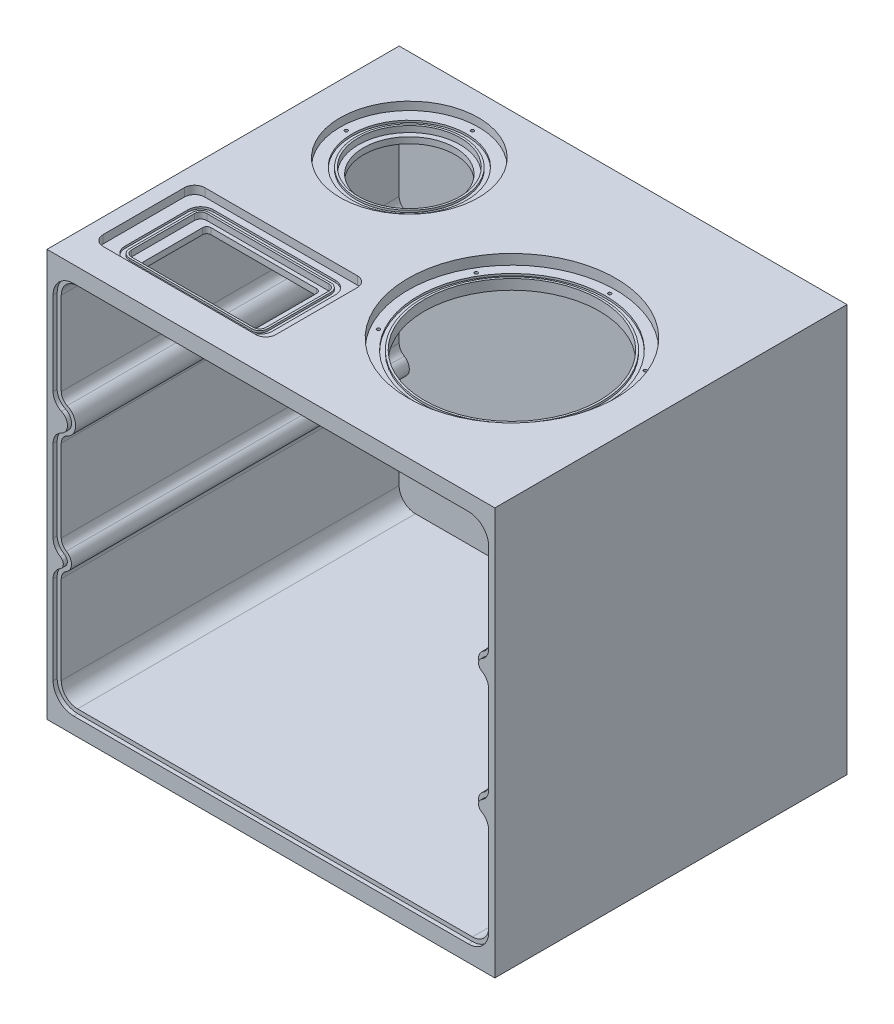
from build123d import *

# Parameters (mm, degrees)
SKETCH1_W           = 220
SKETCH1_H           = 200
BOSS_EXTRUDE1_DEPTH = 5
SKETCH1_3_W         = 220
SKETCH1_3_H         = 200
BOSS_EXTRUDE2_DEPTH = 173
FILLET1_R           = 8
FILLET2_R           = 5
SKETCH4_R           = 43
CUT_EXTRUDE3_DEPTH  = 10
SKETCH4_3_R         = 51
CUT_EXTRUDE4_DEPTH  = 5
SKETCH4_5_R         = 46
SKETCH4_5_R_2       = 44
CUT_EXTRUDE6_DEPTH  = 6
CUT_EXTRUDE9_DEPTH  = 2
SKETCH5_R           = 0.7835
CUT_EXTRUDE7_DEPTH  = 4
SKETCH6_W           = 56
SKETCH6_H           = 33
CUT_EXTRUDE8_DEPTH  = 10
SKETCH6_3_W         = 85
SKETCH6_3_H         = 50
CUT_EXTRUDE10_DEPTH = 4
SKETCH6_4_W         = 66
SKETCH6_4_H         = 37
SKETCH6_4_W_2       = 56
SKETCH6_4_H_2       = 33
CUT_EXTRUDE11_DEPTH = 7
SKETCH6_5_W         = 72.4
SKETCH6_5_H         = 43.4
SKETCH6_5_W_2       = 68
SKETCH6_5_H_2       = 39
CUT_EXTRUDE12_DEPTH = 5
FILLET3_R           = 2
FILLET4_R           = 3
FILLET5_R           = 4
FILLET6_R           = 6.2
FILLET7_R           = 5
SKETCH7_R           = 22.5
CUT_EXTRUDE13_DEPTH = 10
SKETCH7_3_R         = 25
SKETCH7_3_R_2       = 22.5
CUT_EXTRUDE14_DEPTH = 7
SKETCH7_4_R         = 34
SKETCH7_4_R_2       = 28.2
SKETCH7_4_R_3       = 26
SKETCH7_4_R_4       = 25
CUT_EXTRUDE15_DEPTH = 4
SKETCH7_5_R         = 28.2
SKETCH7_5_R_2       = 26
CUT_EXTRUDE16_DEPTH = 5
SKETCH8_R           = 0.7835
CUT_EXTRUDE17_DEPTH = 5


with BuildPart() as part:
    # Sketch1 → Boss-Extrude1 (new body)
    with BuildSketch(Plane.XY):
        Rectangle(SKETCH1_W, SKETCH1_H)
    extrude(amount=BOSS_EXTRUDE1_DEPTH)

    # Sketch1<3> → Boss-Extrude2 (add)
    with BuildSketch(Plane.XY):
        Rectangle(SKETCH1_3_W, SKETCH1_3_H)
        with BuildLine():
            Line((-105, 22.92983697), (-105, -25))
            ThreePointArc((-105, -25), (-100, -30), (-105, -35))
            Line((-105, -35), (-105, -90))
            Line((-105, -90), (105, -90))
            Line((105, -90), (105, -35))
            ThreePointArc((105, -35), (100, -30), (105, -25))
            Line((105, -25), (105, 25))
            ThreePointArc((105, 25), (100, 30), (105, 35))
            Line((105, 35), (105, 90))
            Line((105, 90), (-105, 90))
            Line((-105, 90), (-105, 37.07016303))
            ThreePointArc((-105, 37.07016303), (-97.92983697, 30), (-105, 22.92983697))
        make_face(mode=Mode.SUBTRACT)
    extrude(amount=BOSS_EXTRUDE2_DEPTH)

    # Fillet1
    fillet1_edges = [part.edges().sort_by_distance(p)[0] for p in [
        (105, -90, 89),
        (-105, -90, 89),
        (105, 90, 89),
        (-105, 90, 89),
    ]]
    fillet(fillet1_edges, radius=FILLET1_R)

    # Fillet2
    fillet2_edges = [part.edges().sort_by_distance(p)[0] for p in [
        (105, -35, 89),
        (105, -25, 89),
        (105, 35, 89),
        (105, 25, 89),
        (-105, 37.07016303, 89),
        (-105, 22.92983697, 89),
        (-105, -25, 89),
        (-105, -35, 89),
    ]]
    fillet(fillet2_edges, radius=FILLET2_R)

    # Sketch4 → Cut-Extrude3 (cut)
    with BuildSketch(Plane(origin=(0, 100, 0), x_dir=(1, 0, 0), z_dir=(0, 1, 0))):
        with Locations((42, -96.6)):
            Circle(SKETCH4_R)
    extrude(amount=-CUT_EXTRUDE3_DEPTH, mode=Mode.SUBTRACT)

    # Sketch4<3> → Cut-Extrude4 (cut)
    with BuildSketch(Plane(origin=(0, 100, 0), x_dir=(1, 0, 0), z_dir=(0, 1, 0))):
        with Locations((42, -96.6)):
            Circle(SKETCH4_3_R)
    extrude(amount=-CUT_EXTRUDE4_DEPTH, mode=Mode.SUBTRACT)

    # Sketch4<5> → Cut-Extrude6 (cut)
    with BuildSketch(Plane(origin=(0, 100, 0), x_dir=(1, 0, 0), z_dir=(0, 1, 0))):
        with Locations((42, -96.6)):
            Circle(SKETCH4_5_R)
        with Locations((42, -96.6)):
            Circle(SKETCH4_5_R_2, mode=Mode.SUBTRACT)
    extrude(amount=-CUT_EXTRUDE6_DEPTH, mode=Mode.SUBTRACT)

    # Sketch2 → Cut-Extrude9 (cut)
    with BuildSketch(Plane.XY.offset(173)):
        with BuildLine():
            Line((107, -82), (107, -38.660254038))
            ThreePointArc((107, -38.660254038), (106.062177826, -35.160254038), (103.5, -32.598076211))
            ThreePointArc((103.5, -32.598076211), (102, -30), (103.5, -27.401923789))
            ThreePointArc((103.5, -27.401923789), (106.062177826, -24.839745962), (107, -21.339745962))
            Line((107, -21.339745962), (107, 21.339745962))
            ThreePointArc((107, 21.339745962), (106.062177826, 24.839745962), (103.5, 27.401923789))
            ThreePointArc((103.5, 27.401923789), (102, 30), (103.5, 32.598076211))
            ThreePointArc((103.5, 32.598076211), (106.062177826, 35.160254038), (107, 38.660254038))
            Line((107, 38.660254038), (107, 82))
            ThreePointArc((107, 82), (104.071067812, 89.071067812), (97, 92))
            Line((97, 92), (-97, 92))
            ThreePointArc((-97, 92), (-104.071067812, 89.071067812), (-107, 82))
            Line((-107, 82), (-107, 40.985847057))
            ThreePointArc((-107, 40.985847057), (-105.886339524, 37.197574759), (-102.899712283, 34.614687926))
            ThreePointArc((-102.899712283, 34.614687926), (-99.92983697, 30), (-102.899712283, 25.385312074))
            ThreePointArc((-102.899712283, 25.385312074), (-105.886339524, 22.802425241), (-107, 19.014152943))
            Line((-107, 19.014152943), (-107, -21.339745962))
            ThreePointArc((-107, -21.339745962), (-106.062177826, -24.839745962), (-103.5, -27.401923789))
            ThreePointArc((-103.5, -27.401923789), (-102, -30), (-103.5, -32.598076211))
            ThreePointArc((-103.5, -32.598076211), (-106.062177826, -35.160254038), (-107, -38.660254038))
            Line((-107, -38.660254038), (-107, -82))
            ThreePointArc((-107, -82), (-104.071067812, -89.071067812), (-97, -92))
            Line((-97, -92), (97, -92))
            ThreePointArc((97, -92), (104.071067812, -89.071067812), (107, -82))
        make_face()
        with BuildLine():
            Line((105, -82), (105, -38.660254038))
            ThreePointArc((105, -38.660254038), (104.330127019, -36.160254038), (102.5, -34.330127019))
            ThreePointArc((102.5, -34.330127019), (100, -30), (102.5, -25.669872981))
            ThreePointArc((102.5, -25.669872981), (104.330127019, -23.839745962), (105, -21.339745962))
            Line((105, -21.339745962), (105, 21.339745962))
            ThreePointArc((105, 21.339745962), (104.330127019, 23.839745962), (102.5, 25.669872981))
            ThreePointArc((102.5, 25.669872981), (100, 30), (102.5, 34.330127019))
            ThreePointArc((102.5, 34.330127019), (104.330127019, 36.160254038), (105, 38.660254038))
            Line((105, 38.660254038), (105, 82))
            ThreePointArc((105, 82), (102.656854249, 87.656854249), (97, 90))
            Line((97, 90), (-97, 90))
            ThreePointArc((-97, 90), (-102.656854249, 87.656854249), (-105, 82))
            Line((-105, 82), (-105, 40.985847057))
            ThreePointArc((-105, 40.985847057), (-104.204528231, 38.279938273), (-102.07122306, 36.435019107))
            ThreePointArc((-102.07122306, 36.435019107), (-97.92983697, 30), (-102.07122306, 23.564980893))
            ThreePointArc((-102.07122306, 23.564980893), (-104.204528231, 21.720061727), (-105, 19.014152943))
            Line((-105, 19.014152943), (-105, -21.339745962))
            ThreePointArc((-105, -21.339745962), (-104.330127019, -23.839745962), (-102.5, -25.669872981))
            ThreePointArc((-102.5, -25.669872981), (-100, -30), (-102.5, -34.330127019))
            ThreePointArc((-102.5, -34.330127019), (-104.330127019, -36.160254038), (-105, -38.660254038))
            Line((-105, -38.660254038), (-105, -82))
            ThreePointArc((-105, -82), (-102.656854249, -87.656854249), (-97, -90))
            Line((-97, -90), (97, -90))
            ThreePointArc((97, -90), (102.656854249, -87.656854249), (105, -82))
        make_face(mode=Mode.SUBTRACT)
    extrude(amount=-CUT_EXTRUDE9_DEPTH, mode=Mode.SUBTRACT)

    # Sketch5 → Cut-Extrude7 (cut)
    with BuildSketch(Plane(origin=(0, 95, 0), x_dir=(1, 0, 0), z_dir=(0, 1, 0))):
        with Locations((42, -48.6)):
            Circle(SKETCH5_R)
        with Locations((83.569219382, -72.6)):
            Circle(SKETCH5_R)
        with Locations((83.569219382, -120.6)):
            Circle(SKETCH5_R)
        with Locations((42, -144.6)):
            Circle(SKETCH5_R)
        with Locations((0.430780618, -120.6)):
            Circle(SKETCH5_R)
        with Locations((0.430780618, -72.6)):
            Circle(SKETCH5_R)
    extrude(amount=-CUT_EXTRUDE7_DEPTH, mode=Mode.SUBTRACT)

    # Sketch6 → Cut-Extrude8 (cut)
    with BuildSketch(Plane(origin=(0, 100, 0), x_dir=(1, 0, 0), z_dir=(0, 1, 0))):
        with Locations((-60, -133)):
            Rectangle(SKETCH6_W, SKETCH6_H)
    extrude(amount=-CUT_EXTRUDE8_DEPTH, mode=Mode.SUBTRACT)

    # Sketch6<3> → Cut-Extrude10 (cut)
    with BuildSketch(Plane(origin=(0, 100, 0), x_dir=(1, 0, 0), z_dir=(0, 1, 0))):
        with Locations((-60, -133)):
            Rectangle(SKETCH6_3_W, SKETCH6_3_H)
    extrude(amount=-CUT_EXTRUDE10_DEPTH, mode=Mode.SUBTRACT)

    # Sketch6<4> → Cut-Extrude11 (cut)
    with BuildSketch(Plane(origin=(0, 100, 0), x_dir=(1, 0, 0), z_dir=(0, 1, 0))):
        with Locations((-60, -133)):
            Rectangle(SKETCH6_4_W, SKETCH6_4_H)
        with Locations((-60, -133)):
            Rectangle(SKETCH6_4_W_2, SKETCH6_4_H_2, mode=Mode.SUBTRACT)
    extrude(amount=-CUT_EXTRUDE11_DEPTH, mode=Mode.SUBTRACT)

    # Sketch6<5> → Cut-Extrude12 (cut)
    with BuildSketch(Plane(origin=(0, 100, 0), x_dir=(1, 0, 0), z_dir=(0, 1, 0))):
        with Locations((-60, -133)):
            Rectangle(SKETCH6_5_W, SKETCH6_5_H)
        with Locations((-60, -133)):
            Rectangle(SKETCH6_5_W_2, SKETCH6_5_H_2, mode=Mode.SUBTRACT)
    extrude(amount=-CUT_EXTRUDE12_DEPTH, mode=Mode.SUBTRACT)

    # Fillet3
    fillet3_edges = [part.edges().sort_by_distance(p)[0] for p in [
        (-32, 91.5, 149.5),
        (-88, 91.5, 149.5),
        (-32, 91.5, 116.5),
        (-88, 91.5, 116.5),
    ]]
    fillet(fillet3_edges, radius=FILLET3_R)

    # Fillet4
    fillet4_edges = [part.edges().sort_by_distance(p)[0] for p in [
        (-27, 94.5, 151.5),
        (-93, 94.5, 151.5),
        (-27, 94.5, 114.5),
        (-93, 94.5, 114.5),
    ]]
    fillet(fillet4_edges, radius=FILLET4_R)

    # Fillet5
    fillet5_edges = [part.edges().sort_by_distance(p)[0] for p in [
        (-26, 95.5, 152.5),
        (-26, 95.5, 113.5),
        (-94, 95.5, 152.5),
        (-94, 95.5, 113.5),
    ]]
    fillet(fillet5_edges, radius=FILLET5_R)

    # Fillet6
    fillet6_edges = [part.edges().sort_by_distance(p)[0] for p in [
        (-23.8, 95.5, 154.7),
        (-96.2, 95.5, 154.7),
        (-23.8, 95.5, 111.3),
        (-96.2, 95.5, 111.3),
    ]]
    fillet(fillet6_edges, radius=FILLET6_R)

    # Fillet7
    fillet7_edges = [part.edges().sort_by_distance(p)[0] for p in [
        (-17.5, 98, 158),
        (-102.5, 98, 158),
        (-17.5, 98, 108),
        (-102.5, 98, 108),
    ]]
    fillet(fillet7_edges, radius=FILLET7_R)

    # Sketch7 → Cut-Extrude13 (cut)
    with BuildSketch(Plane(origin=(0, 100, 0), x_dir=(1, 0, 0), z_dir=(0, 1, 0))):
        with Locations((-60, -45)):
            Circle(SKETCH7_R)
    extrude(amount=-CUT_EXTRUDE13_DEPTH, mode=Mode.SUBTRACT)

    # Sketch7<3> → Cut-Extrude14 (cut)
    with BuildSketch(Plane(origin=(0, 100, 0), x_dir=(1, 0, 0), z_dir=(0, 1, 0))):
        with Locations((-60, -45)):
            Circle(SKETCH7_3_R)
        with Locations((-60, -45)):
            Circle(SKETCH7_3_R_2, mode=Mode.SUBTRACT)
    extrude(amount=-CUT_EXTRUDE14_DEPTH, mode=Mode.SUBTRACT)

    # Sketch7<4> → Cut-Extrude15 (cut)
    # profile 1 of 2: a face of its own
    with BuildSketch(Plane(origin=(0, 100, 0), x_dir=(1, 0, 0), z_dir=(0, 1, 0))):
        with Locations((-60, -45)):
            Circle(SKETCH7_4_R)
        with Locations((-60, -45)):
            Circle(SKETCH7_4_R_2, mode=Mode.SUBTRACT)
    # profile 2 of 2: a face of its own
    with BuildSketch(Plane(origin=(0, 100, 0), x_dir=(1, 0, 0), z_dir=(0, 1, 0))):
        with Locations((-60, -45)):
            Circle(SKETCH7_4_R_3)
        with Locations((-60, -45)):
            Circle(SKETCH7_4_R_4, mode=Mode.SUBTRACT)
    extrude(amount=-CUT_EXTRUDE15_DEPTH, mode=Mode.SUBTRACT)

    # Sketch7<5> → Cut-Extrude16 (cut)
    with BuildSketch(Plane(origin=(0, 100, 0), x_dir=(1, 0, 0), z_dir=(0, 1, 0))):
        with Locations((-60, -45)):
            Circle(SKETCH7_5_R)
        with Locations((-60, -45)):
            Circle(SKETCH7_5_R_2, mode=Mode.SUBTRACT)
    extrude(amount=-CUT_EXTRUDE16_DEPTH, mode=Mode.SUBTRACT)

    # Sketch8 → Cut-Extrude17 (cut)
    with BuildSketch(Plane(origin=(0, 96, 0), x_dir=(1, 0, 0), z_dir=(0, 1, 0))):
        with Locations((-60, -14)):
            Circle(SKETCH8_R)
        with Locations((-29, -45)):
            Circle(SKETCH8_R)
        with Locations((-60, -76)):
            Circle(SKETCH8_R)
        with Locations((-91, -45)):
            Circle(SKETCH8_R)
    extrude(amount=-CUT_EXTRUDE17_DEPTH, mode=Mode.SUBTRACT)


solid = part.part
